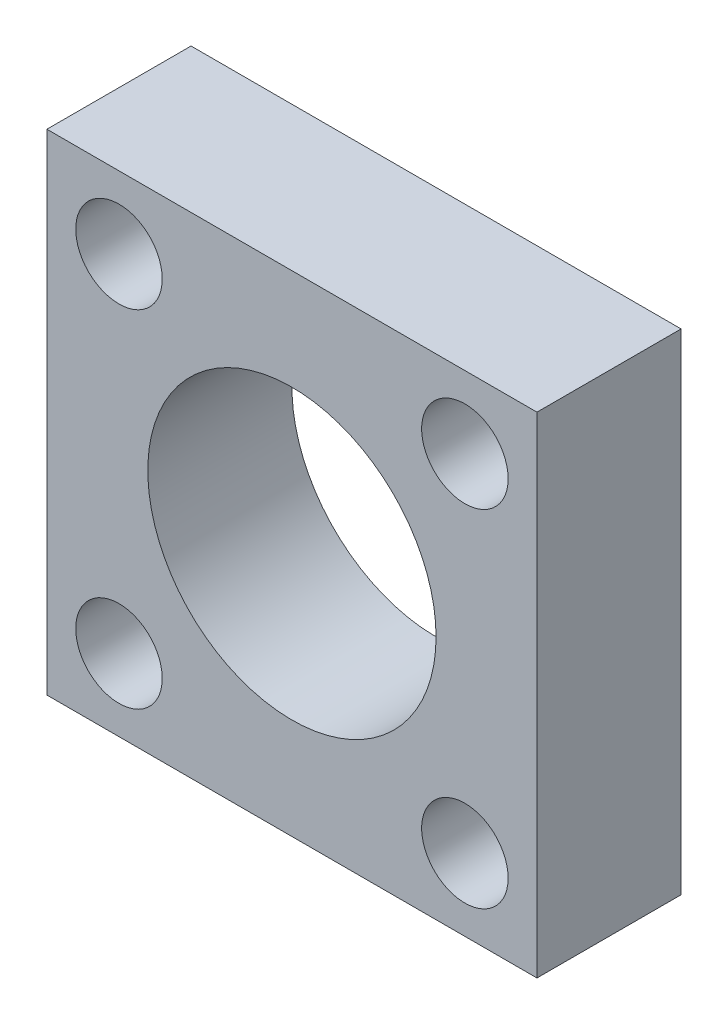
from build123d import *

# Parameters (mm, degrees)
SKETCH1_W            = 34
SKETCH1_H            = 34
SKETCH1_R            = 10
BOSS_EXTRUDE1_DEPTH  = 10
SKETCH2_R            = 3
CUT_EXTRUDE1_DEPTH   = 5
LPATTERN1_COUNT      = 2
LPATTERN1_PITCH      = 24
LPATTERN1_COUNT_DIR2 = 2
LPATTERN1_PITCH_DIR2 = 24


with BuildPart() as part:
    # Sketch1 → Boss-Extrude1 (new body)
    with BuildSketch(Plane.XY):
        with Locations((-1.444444444, -4.888888889)):
            Rectangle(SKETCH1_W, SKETCH1_H)
        with Locations((-1.444444444, -4.888888889)):
            Circle(SKETCH1_R, mode=Mode.SUBTRACT)
    extrude(amount=BOSS_EXTRUDE1_DEPTH)

    # Sketch2 → Cut-Extrude1 (cut)
    with BuildSketch(Plane.XY.offset(10)):
        with Locations((-13.444444444, 7.111111111)):
            Circle(SKETCH2_R)
    cut_extrude1 = extrude(amount=-CUT_EXTRUDE1_DEPTH, mode=Mode.SUBTRACT)

    # LPattern1: Cut-Extrude1 2 × 2
    with Locations(*[(i * LPATTERN1_PITCH, -j * LPATTERN1_PITCH_DIR2, 0) for i in range(LPATTERN1_COUNT) for j in range(LPATTERN1_COUNT_DIR2) if (i, j) != (0, 0)]):
        add(cut_extrude1, mode=Mode.SUBTRACT)


solid = part.part
